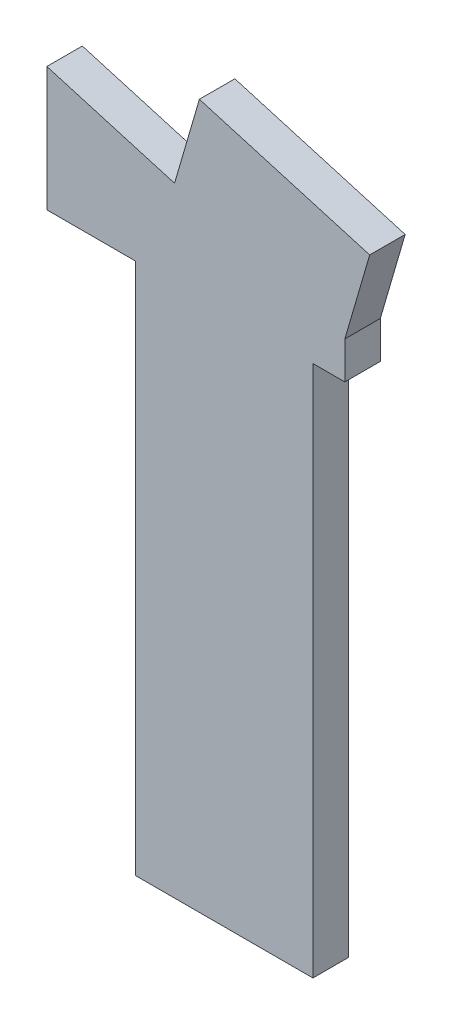
from build123d import *

# Parameters (mm, degrees)
BOSS_EXTRUDE1_DEPTH = 2


with BuildPart() as part:
    # Sketch2 → Boss-Extrude1 (new body)
    with BuildSketch(Plane.XY):
        Polygon((0, 7), (0, 0), (5, 0), (5, -30), (15, -30), (15, 0), (16.8, 0), (16.8, 2.1), (18.2, 6.9), (8.6, 9.7), (7.2, 4.9), align=None)
    extrude(amount=BOSS_EXTRUDE1_DEPTH)


solid = part.part
